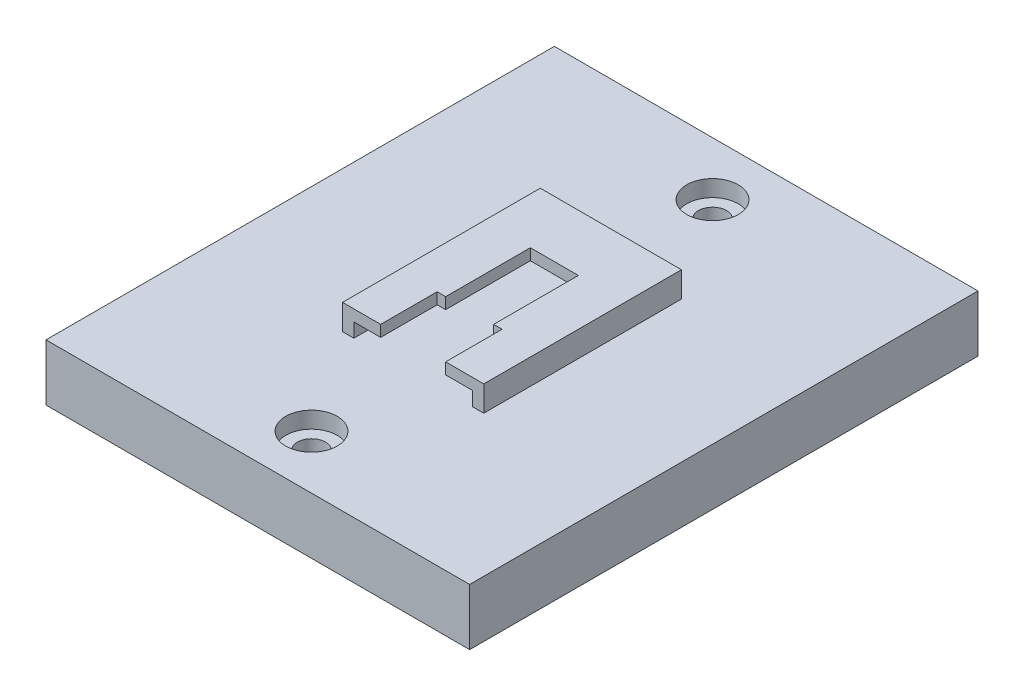
from build123d import *

# Parameters (mm, degrees)
BOSS_EXTRUDE1_DEPTH                             = 2
BOSS_EXTRUDE2_DEPTH                             = 2.5
SKETCH3_W                                       = 75
SKETCH3_H                                       = 90
BOSS_EXTRUDE3_DEPTH                             = 10
CBORE_FOR_8_PAN_HEAD_MACHINE_SCREW1_D           = 4.9784
CBORE_FOR_8_PAN_HEAD_MACHINE_SCREW1_CBORE_D     = 9.12876
CBORE_FOR_8_PAN_HEAD_MACHINE_SCREW1_CBORE_DEPTH = 2.921


with BuildPart() as part:
    # Sketch1 → Boss-Extrude1 (new body)
    with BuildSketch(Plane(origin=(0, 0, 0), x_dir=(1, 0, 0), z_dir=(0, 1, 0))):
        Polygon((12.5, 17.5), (-12.5, 17.5), (-12.5, -17.5), (-5.75, -17.5), (-5.75, -7.5), (-4.25, -7.5), (-4.25, 7.5), (4.25, 7.5), (4.25, -7.5), (5.75, -7.5), (5.75, -17.5), (12.5, -17.5), align=None)
    extrude(amount=BOSS_EXTRUDE1_DEPTH)

    # Sketch2 → Boss-Extrude2 (add)
    with BuildSketch(Plane.XZ):
        Polygon((-12.5, 17.5), (-12.5, -17.5), (12.5, -17.5), (12.5, 17.5), (10.5, 17.5), (10.5, -15.5), (-10.5, -15.5), (-10.5, 17.5), align=None)
    extrude(amount=BOSS_EXTRUDE2_DEPTH)

    # Sketch3 → Boss-Extrude3 (add)
    with BuildSketch(Plane.XZ.offset(2.5)):
        Rectangle(SKETCH3_W, SKETCH3_H)
    extrude(amount=BOSS_EXTRUDE3_DEPTH)

    # CBORE for #8 Pan Head Machine Screw1 (through all)
    with Locations(Plane(origin=(0, -2.5, 0), x_dir=(1, 0, 0), z_dir=(0, 1, 0))):
        with Locations((0, 35.5), (0, -35.5)):
            CounterBoreHole(CBORE_FOR_8_PAN_HEAD_MACHINE_SCREW1_D / 2, CBORE_FOR_8_PAN_HEAD_MACHINE_SCREW1_CBORE_D / 2, CBORE_FOR_8_PAN_HEAD_MACHINE_SCREW1_CBORE_DEPTH)


solid = part.part
